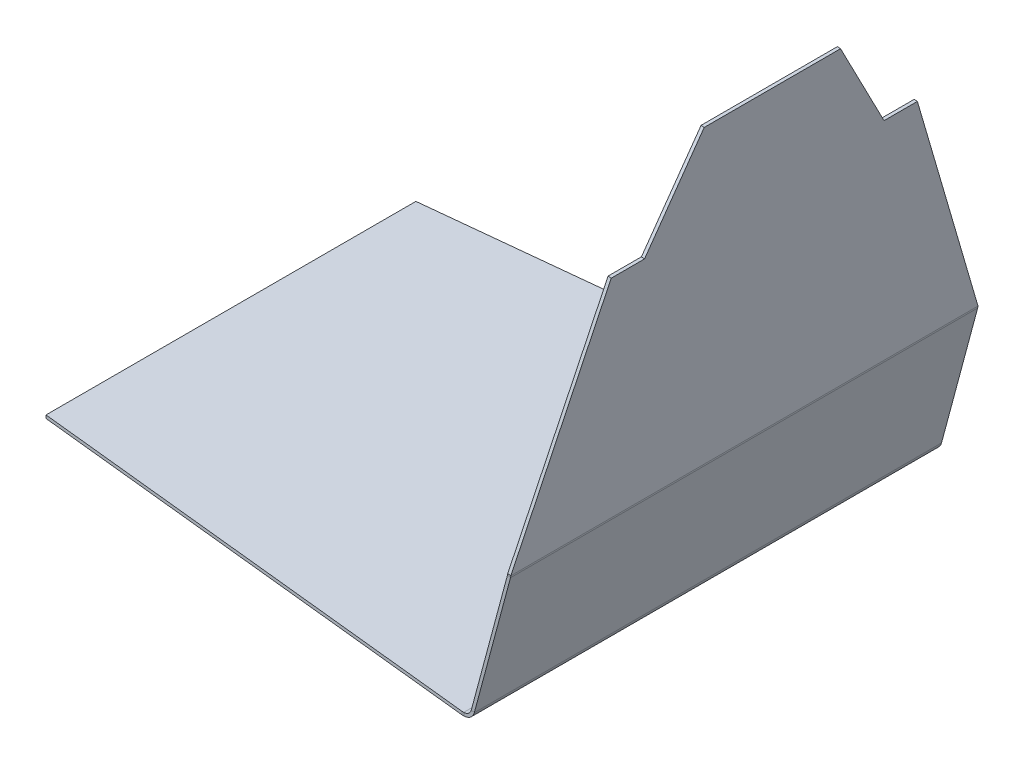
from build123d import *

# Parameters (mm, degrees)
BOSS_EXTRUDE1_DEPTH          = 10
CONVERT_SOLID1_DEPTH         = 6
EDGE_FLANGE2_DEPTH           = 600
EDGE_FLANGE4_STRIP_CUT_DEPTH = 600
EDGE_FLANGE4_DEPTH           = 600
CUT_EXTRUDE2_DEPTH           = 952.374861111
CUT_EXTRUDE2_DEPTH_BACK      = 952.374861111


# Read off the part's stored shape, not the designer's step: Convert-Solid1
# Sheet-metal steps are written as plain solids
with BuildPart() as part:
    # Sketch1 → Boss-Extrude1 (new body)
    with BuildSketch(Plane(origin=(0, 0, 0), x_dir=(1, 0, 0), z_dir=(0, 1, 0))):
        Polygon((-192.279765905, 0), (-192.279765905, 237.5), (404.456147209, 300), (404.456147209, 0), (404.456147209, -300), (-192.279765905, -237.5), align=None)
    extrude(amount=BOSS_EXTRUDE1_DEPTH)

    # Convert-Solid1 outline → Convert-Solid1 (cut)
    with BuildSketch(Plane(origin=(0, 0, 0), x_dir=(1, 0, 0), z_dir=(0, 1, 0))):
        Polygon((-192.279765905, -237.5), (404.456147209, -300), (404.456147209, 300), (-192.279765905, 237.5), align=None)
    extrude(amount=CONVERT_SOLID1_DEPTH, mode=Mode.SUBTRACT)

    # Edge-Flange2 section (across the edge) → Edge-Flange2 (add)
    with BuildSketch(Plane(origin=(414.456147209, 10, 300), x_dir=(-0.9659258262890673, 0.25881904510252446, 0), z_dir=(0, 0, -1))):
        with BuildLine():
            Line((-4, 7.67326988), (-4, 187.930692048))
            Line((-4, 187.930692048), (0, 187.930692048))
            Line((0, 187.930692048), (0, 7.67326988))
            ThreePointArc((0, 7.67326988), (2.066466597, 1.58565559), (7.411809549, -1.985988383))
            Line((7.411809549, -1.985988383), (9.659258263, -2.588190451))
            Line((9.659258263, -2.588190451), (8.623982082, -6.451893756))
            Line((8.623982082, -6.451893756), (6.376533369, -5.849691688))
            ThreePointArc((6.376533369, -5.849691688), (-1.106946764, -0.849390126), (-4, 7.67326988))
        make_face()
    extrude(amount=EDGE_FLANGE2_DEPTH)

    # Edge-Flange4 strip (across the edge) → Edge-Flange4 strip cut (cut)
    with BuildSketch(Plane(origin=(463.09618947, 191.527109002, 300), x_dir=(-0.9961946980917449, 0.0871557427476667, 0), z_dir=(0, 0, -1))):
        Polygon((-10.038642938, 33.896891256), (-3.787308542, -1.556187852), (0.15192247, -0.861595141), (-6.099411926, 34.591483967), align=None)
    extrude(amount=EDGE_FLANGE4_STRIP_CUT_DEPTH, mode=Mode.SUBTRACT)

    # Edge-Flange4 section (across the edge) → Edge-Flange4 (add)
    with BuildSketch(Plane(origin=(463.09618947, 191.527109002, 300), x_dir=(-0.9961946980917449, 0.0871557427476667, 0), z_dir=(0, 0, -1))):
        with BuildLine():
            Line((-4, 0.874886635), (-4, 412.850045346))
            Line((-4, 412.850045346), (0, 412.850045346))
            Line((0, 412.850045346), (0, 0.874886635))
            ThreePointArc((0, 0.874886635), (0.038053019, 0.003329208), (0.15192247, -0.861595141))
            Line((0.15192247, -0.861595141), (-3.787308542, -1.556187852))
            ThreePointArc((-3.787308542, -1.556187852), (-3.946725773, -0.345293763), (-4, 0.874886635))
        make_face()
    extrude(amount=EDGE_FLANGE4_DEPTH)

    # Sketch22 → Cut-Extrude2 (cut, two sides: drawn at the far end of the back side and taken through both)
    with BuildSketch(Plane(origin=(442.9492869, -38.753041121, 0), x_dir=(0, 0, 1), z_dir=(-0.9961946980917449, 0.08715574274766662, 0)).offset(-CUT_EXTRUDE2_DEPTH_BACK)):
        Polygon((300, 232.03466952), (196.591479546, 525.272945681), (153.798650158, 525.272945681), (87.551647761, 644.009828231), (302.699803465, 645.121208779), (304.833664863, 232.03466952), align=None)
        Polygon((-300, 232.03466952), (-196.591479546, 525.272945681), (-153.798650158, 525.272945681), (-87.551647761, 644.009828231), (-302.699803465, 645.121208779), (-304.833664863, 232.03466952), align=None)
    extrude(amount=CUT_EXTRUDE2_DEPTH + CUT_EXTRUDE2_DEPTH_BACK, mode=Mode.SUBTRACT)


solid = part.part
